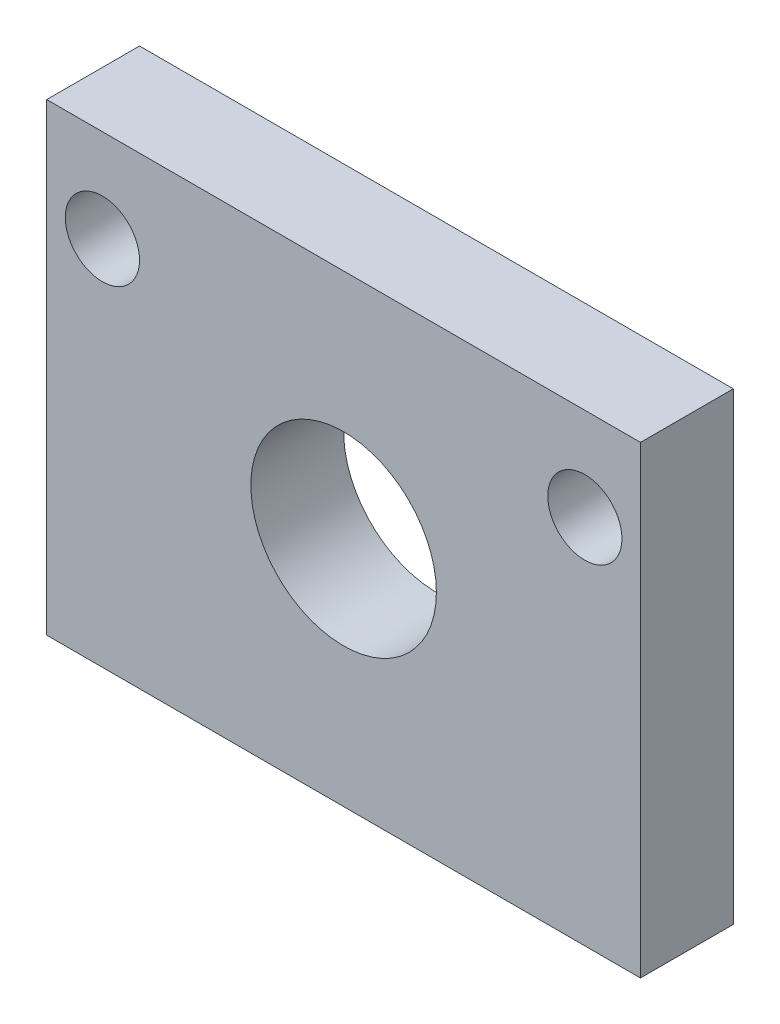
from build123d import *

# Parameters (mm, degrees)
CROQUIS1_W              = 32
CROQUIS1_H              = 25
CROQUIS1_R              = 5
CROQUIS1_R_2            = 2
SALIENTE_EXTRUIR1_DEPTH = 5


with BuildPart() as part:
    # Croquis1 → Saliente-Extruir1 (new body)
    with BuildSketch(Plane.XY):
        Rectangle(CROQUIS1_W, CROQUIS1_H)
        Circle(CROQUIS1_R, mode=Mode.SUBTRACT)
        with Locations((-13, 7.5)):
            Circle(CROQUIS1_R_2, mode=Mode.SUBTRACT)
        with Locations((13, 7.5)):
            Circle(CROQUIS1_R_2, mode=Mode.SUBTRACT)
    extrude(amount=SALIENTE_EXTRUIR1_DEPTH)


solid = part.part
